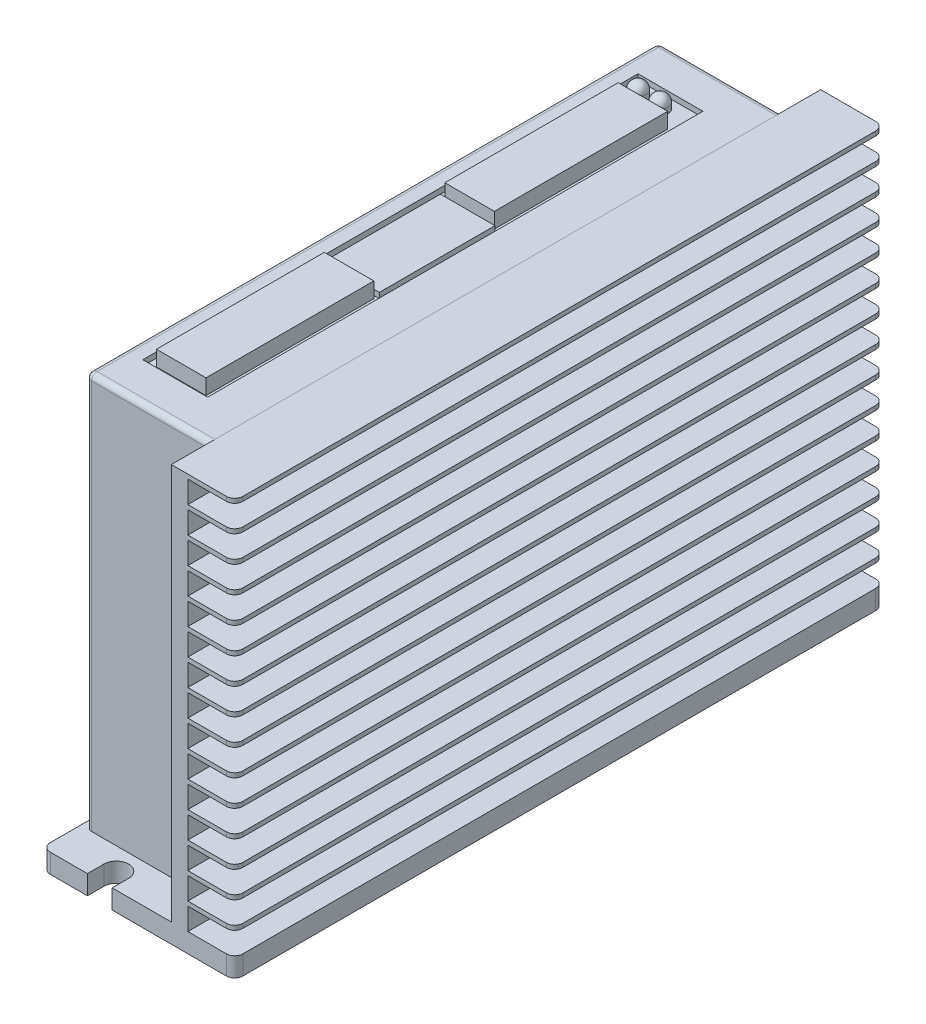
from build123d import *

# Parameters (mm, degrees)
BOSS_EXTRUDE1_DEPTH = 59
FILLET1_R           = 1.5
SKETCH2_W           = 8.5
SKETCH2_H           = 4
CUT_EXTRUDE1_DEPTH  = 145.392693721
LPATTERN1_COUNT     = 15
LPATTERN1_PITCH     = 4.8
SKETCH3_W           = 104
SKETCH3_H           = 71.9
BOSS_EXTRUDE2_DEPTH = 22.5
SKETCH4_W           = 35
SKETCH4_H           = 3.5
CUT_EXTRUDE2_DEPTH  = 1
CUT_EXTRUDE3_REACH  = 104.011
SKETCH8_W           = 11.8
SKETCH8_H           = 90
CUT_EXTRUDE4_DEPTH  = 1
SKETCH9_W           = 9
SKETCH9_H           = 30.5
SKETCH9_H_2         = 31.5
BOSS_EXTRUDE4_DEPTH = 2.8
SKETCH10_W          = 9.9
SKETCH10_H          = 21
BOSS_EXTRUDE5_DEPTH = 1
SKETCH11_R          = 1.5
BOSS_EXTRUDE6_DEPTH = 1
FILLET2_R           = 1


# Read off the part's stored shape, not the designer's step: Dome1, Dome2
with BuildPart() as part:
    # Sketch1 → Boss-Extrude1 (new, symmetric)
    with BuildSketch(Plane.XY):
        Polygon((0, 0), (35, 0), (35, 75.5), (23.5, 75.5), (23.5, 3.5), (0, 3.5), align=None)
    extrude(amount=BOSS_EXTRUDE1_DEPTH, both=True)

    # Fillet1
    fillet1_edges = [part.edges().sort_by_distance(p)[0] for p in [
        (35, 37.75, 59),
        (0, 1.75, 59),
        (35, 37.75, -59),
        (0, 1.75, -59),
    ]]
    fillet(fillet1_edges, radius=FILLET1_R)

    # Sketch2 → Cut-Extrude1 (cut, through all)
    with BuildSketch(Plane.XY.offset(59)):
        with Locations((30.75, 5.5)):
            Rectangle(SKETCH2_W, SKETCH2_H)
    cut_extrude1 = extrude(amount=-CUT_EXTRUDE1_DEPTH, mode=Mode.SUBTRACT)

    # LPattern1: Cut-Extrude1 ×15
    with Locations(*[(0, i * LPATTERN1_PITCH, 0) for i in range(1, LPATTERN1_COUNT)]):
        add(cut_extrude1, mode=Mode.SUBTRACT)

    # Sketch3 → Boss-Extrude2 (add)
    with BuildSketch(Plane.ZY.offset(-23.5)):
        with Locations((0, 39.45)):
            Rectangle(SKETCH3_W, SKETCH3_H)
    extrude(amount=BOSS_EXTRUDE2_DEPTH)

    # Sketch4 → Cut-Extrude2 (cut)
    with BuildSketch(Plane.ZY):
        with Locations((0, 1.75)):
            Rectangle(SKETCH4_W, SKETCH4_H)
    extrude(amount=-CUT_EXTRUDE2_DEPTH, mode=Mode.SUBTRACT)

    # Sketch5 → Cut-Extrude3 (cut, up to next)
    with BuildSketch(Plane.XZ, mode=Mode.PRIVATE) as cut_extrude3_sk1:
        with BuildLine():
            Line((12.75, 59), (12.75, 56))
            ThreePointArc((12.75, 56), (10.5, 53.75), (8.25, 56))
            Line((8.25, 56), (8.25, 59))
            ThreePointArc((8.25, 59), (10.5, 61.25), (12.75, 59))
        make_face()
    cut_extrude3_tool1 = extrude(cut_extrude3_sk1.sketch, amount=-CUT_EXTRUDE3_REACH, mode=Mode.PRIVATE) & part.part
    # Sketch5 → Cut-Extrude3 (cut, up to next)
    with BuildSketch(Plane.XZ, mode=Mode.PRIVATE) as cut_extrude3_sk2:
        with BuildLine():
            Line((12.75, -59), (12.75, -56))
            ThreePointArc((12.75, -56), (10.5, -53.75), (8.25, -56))
            Line((8.25, -56), (8.25, -59))
            ThreePointArc((8.25, -59), (10.5, -61.25), (12.75, -59))
        make_face()
    cut_extrude3_tool2 = extrude(cut_extrude3_sk2.sketch, amount=-CUT_EXTRUDE3_REACH, mode=Mode.PRIVATE) & part.part
    add(cut_extrude3_tool1.solids().sort_by_distance((10.5, 0, 57.5))[0], mode=Mode.SUBTRACT)
    add(cut_extrude3_tool2.solids().sort_by_distance((10.5, 0, -57.5))[0], mode=Mode.SUBTRACT)

    # Sketch8 → Cut-Extrude4 (cut)
    with BuildSketch(Plane(origin=(0, 75.4, 0), x_dir=(1, 0, 0), z_dir=(0, 1, 0))):
        with Locations((10.2, 0)):
            Rectangle(SKETCH8_W, SKETCH8_H)
    extrude(amount=-CUT_EXTRUDE4_DEPTH, mode=Mode.SUBTRACT)

    # Sketch9 → Boss-Extrude4 (add)
    with BuildSketch(Plane(origin=(0, 74.4, 0), x_dir=(1, 0, 0), z_dir=(0, 1, 0))):
        with Locations((10.2, -28.65)):
            Rectangle(SKETCH9_W, SKETCH9_H)
        with Locations((10.2, 24.25)):
            Rectangle(SKETCH9_W, SKETCH9_H_2)
    extrude(amount=BOSS_EXTRUDE4_DEPTH)

    # Sketch10 → Boss-Extrude5 (add)
    with BuildSketch(Plane(origin=(0, 74.4, 0), x_dir=(1, 0, 0), z_dir=(0, 1, 0))):
        with Locations((10.25, -2.4)):
            Rectangle(SKETCH10_W, SKETCH10_H)
    extrude(amount=BOSS_EXTRUDE5_DEPTH)

    # Sketch11 → Boss-Extrude6 (add)
    with BuildSketch(Plane(origin=(0, 74.4, 0), x_dir=(1, 0, 0), z_dir=(0, 1, 0))):
        with Locations(Location((6.8, 42.5, 0), (0, 0, 270))):
            Circle(SKETCH11_R)
        with Locations(Location((10.8, 42.5, 0), (0, 0, 270))):
            Circle(SKETCH11_R)
    extrude(amount=BOSS_EXTRUDE6_DEPTH)

    # Dome1 outline → Dome1 (revolve)
    with BuildSketch(Plane(origin=(10.8, 0, -42.5), x_dir=(1, 0, 0), z_dir=(0, 0, 1))):
        with BuildLine():
            Line((0, 75.4), (1.5, 75.399999999))
            ThreePointArc((1.5, 75.399999999), (1.060660172, 76.460660171), (0, 76.9))
            Line((0, 76.9), (0, 75.4))
        make_face()
    revolve(axis=Axis((10.8, 0, -42.5), (0, 1, 0)))

    # Dome2 outline → Dome2 (revolve)
    with BuildSketch(Plane(origin=(6.8, 0, -42.5), x_dir=(1, 0, 0), z_dir=(0, 0, 1))):
        with BuildLine():
            Line((0, 75.4), (1.5, 75.399999999))
            ThreePointArc((1.5, 75.399999999), (1.060660172, 76.460660171), (0, 76.9))
            Line((0, 76.9), (0, 75.4))
        make_face()
    revolve(axis=Axis((6.8, 0, -42.5), (0, 1, 0)))

    # Fillet2
    fillet2_edges = [part.edges().sort_by_distance(p)[0] for p in [
        (1, 75.4, 0),
        (12.25, 75.4, 52),
        (1, 39.45, 52),
        (1, 39.45, -52),
        (12.25, 75.4, -52),
    ]]
    fillet(fillet2_edges, radius=FILLET2_R)


solid = part.part
